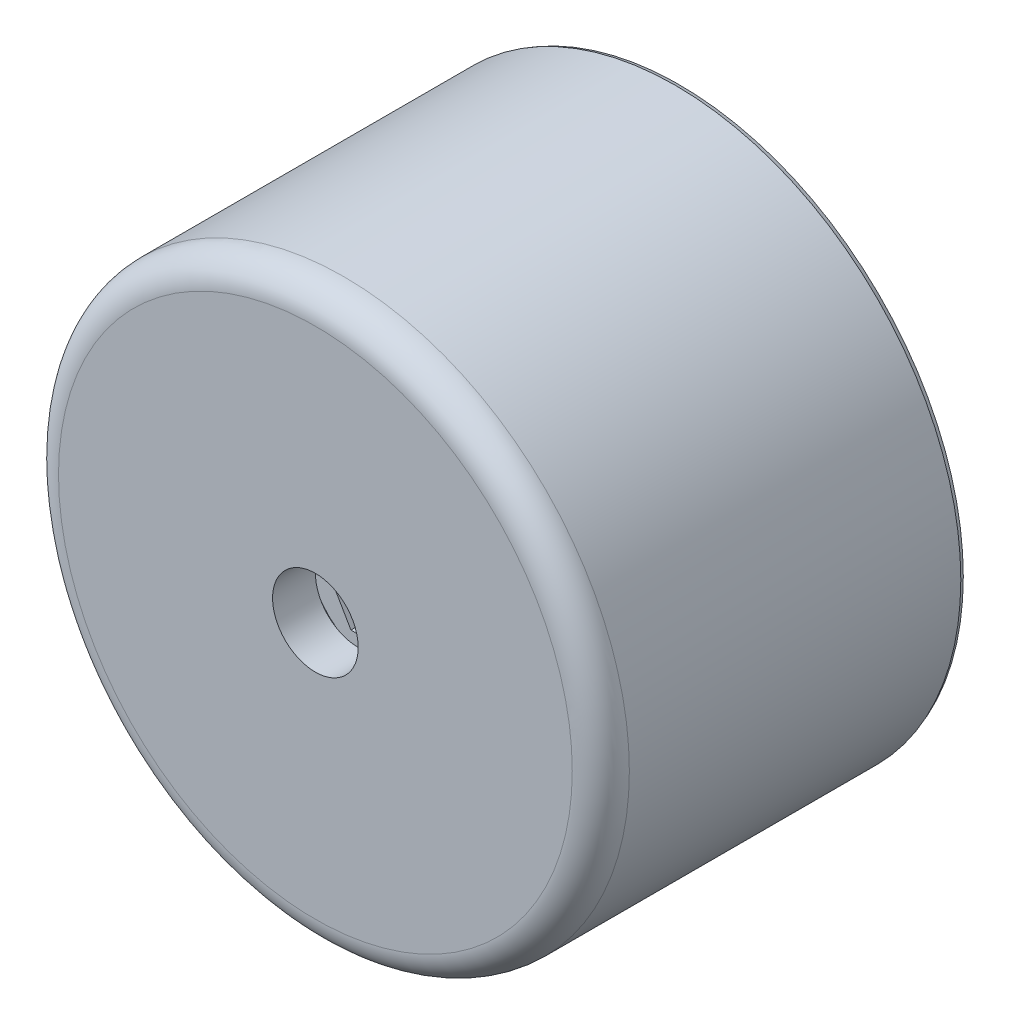
from build123d import *

# Parameters (mm, degrees)
SKETCH1_R                       = 20
SKETCH1_R_2                     = 1
BOSS_EXTRUDE1_DEPTH             = 22.5
TAP_DRILL_FOR_M5X0_8_TAP1_D     = 4.2
TAP_DRILL_FOR_M5X0_8_TAP1_DEPTH = 5
TAP_DRILL_FOR_M5X0_8_TAP1_TIP   = 1.2618073
SKETCH4_W                       = 2.794
SKETCH4_H                       = 6.604
CUT_EXTRUDE1_DEPTH              = 20.5
CIRPATTERN1_COUNT               = 8
CUT_EXTRUDE3_START              = -6
SKETCH6_W                       = 4.62
SKETCH6_H                       = 8
SKETCH6_R                       = 2.1
CUT_EXTRUDE3_DEPTH              = 6
SKETCH7_R                       = 5.5
CUT_EXTRUDE4_DEPTH              = 1.8
SKETCH9_R                       = 3.014010562
CUT_EXTRUDE5_DEPTH              = 2
CHAMFER1_SIZE                   = 2
SKETCH8_R                       = 20
SKETCH8_R_2                     = 3
BOSS_EXTRUDE2_DEPTH             = 3
SKETCH5_R                       = 6
SKETCH5_R_2                     = 5
CUT_EXTRUDE2_DEPTH              = 0.909090909
FILLET3_R                       = 0.5
FILLET4_R                       = 2
CHAMFER2_SIZE                   = 0.1
CHAMFER2_SIZE2                  = 0.274747742


with BuildPart() as part:
    # Sketch1 → Boss-Extrude1 (new body)
    with BuildSketch(Plane.XY):
        with Locations(Location((-11.822558412, 14.529752947, 0), (0, 0, 180))):
            Circle(SKETCH1_R)
        with Locations(Location((-11.822558412, 14.529752947, 0), (0, 0, 180))):
            Circle(SKETCH1_R_2, mode=Mode.SUBTRACT)
    extrude(amount=BOSS_EXTRUDE1_DEPTH)

    # Tap Drill for M5x0.8 Tap1
    with Locations(Plane.XY.offset(22.5)):
        with Locations((-11.822558412, 14.529752947)):
            Hole(TAP_DRILL_FOR_M5X0_8_TAP1_D / 2, depth=TAP_DRILL_FOR_M5X0_8_TAP1_DEPTH)
            with Locations((0, 0, -(TAP_DRILL_FOR_M5X0_8_TAP1_DEPTH + TAP_DRILL_FOR_M5X0_8_TAP1_TIP / 2))):  # 118° drill point
                Cone(0, TAP_DRILL_FOR_M5X0_8_TAP1_D / 2, TAP_DRILL_FOR_M5X0_8_TAP1_TIP, mode=Mode.SUBTRACT)

    # Sketch4 → Cut-Extrude1 (cut)
    with BuildSketch(Plane.XY.offset(22.5)):
        with Locations((4.780441588, 14.531752947)):
            Rectangle(SKETCH4_W, SKETCH4_H)
    cut_extrude1 = extrude(amount=-CUT_EXTRUDE1_DEPTH, mode=Mode.SUBTRACT)

    # CirPattern1: Cut-Extrude1 ×8 about axis
    cirpattern1_axis = Axis((-11.822558412, 14.529752947, 0), (0, 0, 1))
    for i in range(1, CIRPATTERN1_COUNT):
        add(cut_extrude1.rotate(cirpattern1_axis, i * 360 / CIRPATTERN1_COUNT), mode=Mode.SUBTRACT)

    # Sketch6 → Cut-Extrude3 (cut)
    # profile 1 of 4: a face of its own
    with BuildSketch(Plane.XY.offset(22.5).offset(CUT_EXTRUDE3_START)):
        Polygon((-16.444354251, 14.529752947), (-14.132558412, 18.529752947), (-14.132558412, 10.529752947), align=None)
    # profile 2 of 4: a face of its own
    with BuildSketch(Plane.XY.offset(22.5).offset(CUT_EXTRUDE3_START)):
        Polygon((-7.200762573, 14.529752947), (-9.512558412, 10.529752947), (-9.512558412, 18.529752947), align=None)
    # profile 3 of 4: a face of its own
    with BuildSketch(Plane.XY.offset(22.5).offset(CUT_EXTRUDE3_START)):
        with Locations((-11.822558412, 14.529752947)):
            Rectangle(SKETCH6_W, SKETCH6_H)
        with Locations((-11.822558412, 14.529752947)):
            Circle(SKETCH6_R, mode=Mode.SUBTRACT)
    # profile 4 of 4: a face of its own
    with BuildSketch(Plane.XY.offset(22.5).offset(CUT_EXTRUDE3_START)):
        with Locations((-11.822558412, 14.529752947)):
            Circle(SKETCH6_R)
    extrude(amount=CUT_EXTRUDE3_DEPTH, mode=Mode.SUBTRACT)

    # Sketch7 → Cut-Extrude4 (cut)
    with BuildSketch(Plane.XY.offset(22.5)):
        with Locations((-11.822558412, 14.529752947)):
            Circle(SKETCH7_R)
    extrude(amount=-CUT_EXTRUDE4_DEPTH, mode=Mode.SUBTRACT)

    # Sketch9 → Cut-Extrude5 (cut)
    with BuildSketch(Plane.XY.offset(16.5)):
        with Locations((-11.822558412, 14.529752947)):
            Circle(SKETCH9_R)
    extrude(amount=-CUT_EXTRUDE5_DEPTH, mode=Mode.SUBTRACT)

    # Chamfer1
    chamfer1_edges = [part.edges().sort_by_distance(p)[0] for p in [
        (-14.836568974, 14.529752947, 14.5),
    ]]
    chamfer(chamfer1_edges, length=CHAMFER1_SIZE - 0.0001)  # a hair under: the kernel refuses the full size

    # Sketch8 → Boss-Extrude2 (add)
    with BuildSketch(Plane.XY.offset(22.5)):
        with Locations(Location((-11.822558412, 14.529752947, 0), (0, 0, 180))):
            Circle(SKETCH8_R)
        with Locations((-11.822558412, 14.529752947)):
            Circle(SKETCH8_R_2, mode=Mode.SUBTRACT)
    extrude(amount=BOSS_EXTRUDE2_DEPTH)

    # Sketch5 → Cut-Extrude2 (cut)
    with BuildSketch(Plane(origin=(0, 0, 0), x_dir=(-1, 0, 0), z_dir=(0, 0, -1))):
        with Locations((11.822558412, 14.529752947)):
            Circle(SKETCH5_R)
        with Locations((11.822558412, 14.529752947)):
            Circle(SKETCH5_R_2, mode=Mode.SUBTRACT)
    extrude(amount=-CUT_EXTRUDE2_DEPTH, mode=Mode.SUBTRACT)

    # Fillet3
    fillet3_edges = [part.edges().sort_by_distance(p)[0] for p in [
        (-5.822558412, 14.529752947, 0.909090909),
        (-6.822558412, 14.529752947, 0.909090909),
    ]]
    fillet(fillet3_edges, radius=FILLET3_R - 0.0001)  # a hair under: the kernel refuses the full size

    # Fillet4
    fillet4_edges = [part.edges().sort_by_distance(p)[0] for p in [
        (8.177441588, 14.529752947, 25.5),
    ]]
    fillet(fillet4_edges, radius=FILLET4_R)

    # Chamfer2
    chamfer2_edges = [part.edges().sort_by_distance(p)[0] for p in [
        (8.177441588, 14.529752947, 0),
    ]]
    chamfer2_side = [part.faces().sort_by_distance(p)[0] for p in [
        (7.611756163, 14.529752947, 0),
    ]]
    chamfer(chamfer2_edges, length=CHAMFER2_SIZE, length2=CHAMFER2_SIZE2, reference=chamfer2_side[0])


solid = part.part
